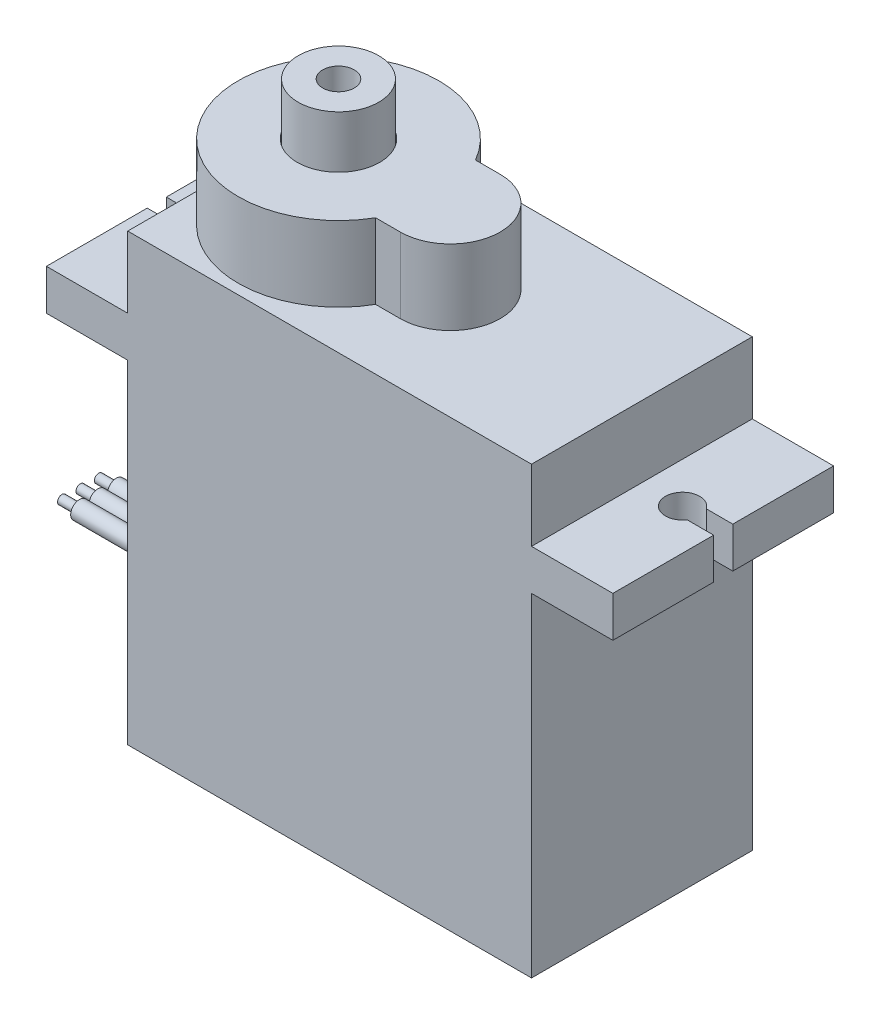
from build123d import *

# Parameters (mm, degrees)
BOSS_EXTRUDE1_DEPTH      = 6.295
BOSS_EXTRUDE2_DEPTH      = 4.28
SKETCH4_R                = 0.975
SKETCH4_W                = 1.511544683
SKETCH4_H                = 1.09
CUT_EXTRUDE1_DEPTH       = 29.67958551
SKETCH5_R                = 1
SKETCH5_R_2              = 0.975
CUT_EXTRUDE2_DEPTH       = 1
SKETCH6_R                = 0.5
BOSS_EXTRUDE4_DEPTH      = 8
SKETCH7_R                = 0.25
BOSS_EXTRUDE5_DEPTH      = 1
FILLET1_R                = 0.3
BOSS_EXTRUDE6_DEPTH      = 2.95
BOSS_EXTRUDE6_DEPTH_BACK = 1
SKETCH12_R               = 2.3
SKETCH12_R_2             = 0.9
SKETCH13_R               = 2.35
CUT_EXTRUDE5_DEPTH       = 5


with BuildPart() as part:
    # Sketch1 → Boss-Extrude1 (new, symmetric)
    with BuildSketch(Plane.XY):
        Polygon((-7.13, 6.38), (15.9, 6.38), (15.9, 2.32), (20.54, 2.32), (20.54, 0), (15.9, 0), (15.9, -19), (-7.13, -19), (-7.13, 0), (-11.77, 0), (-11.77, 2.32), (-7.13, 2.32), align=None)
    extrude(amount=BOSS_EXTRUDE1_DEPTH, both=True)

    # Sketch2 → Boss-Extrude2 (add)
    with BuildSketch(Plane(origin=(0, 6.38, 0), x_dir=(1, 0, 0), z_dir=(0, 1, 0))):
        with BuildLine():
            Line((3.560191336, -2.85), (4.97, -2.85))
            ThreePointArc((4.97, -2.85), (7.82, 0), (4.97, 2.85))
            Line((4.97, 2.85), (3.560191336, 2.85))
            ThreePointArc((3.560191336, 2.85), (-7.13, 0), (3.560191336, -2.85))
        make_face()
    extrude(amount=BOSS_EXTRUDE2_DEPTH)

    # Sketch4 → Cut-Extrude1 (cut, through all)
    with BuildSketch(Plane(origin=(0, 0, 0), x_dir=(1, 0, 0), z_dir=(0, 1, 0))):
        with Locations((-9.45, 0)):
            Circle(SKETCH4_R)
        with Locations((-11.014227659, 0)):
            Rectangle(SKETCH4_W, SKETCH4_H)
    cut_extrude1 = extrude(amount=CUT_EXTRUDE1_DEPTH, mode=Mode.SUBTRACT)

    # Mirror2: Cut-Extrude1 across plane
    add(cut_extrude1.mirror(Plane(origin=(4.385, -13.5, 6.295), x_dir=(0, 0, 1), z_dir=(-1, 0, 0))), mode=Mode.SUBTRACT)

    # Sketch5 → Cut-Extrude2 (cut)
    # profile 1 of 4: a face of its own
    with BuildSketch(Plane.XZ.offset(19)):
        with Locations((-5.49, 4.35)):
            Circle(SKETCH5_R)
        with Locations((-5.49, 4.35)):
            Circle(SKETCH5_R_2, mode=Mode.SUBTRACT)
    # profile 2 of 4: a face of its own
    with BuildSketch(Plane.XZ.offset(19)):
        with Locations((-5.49, -4.35)):
            Circle(SKETCH5_R)
        with Locations((-5.49, -4.35)):
            Circle(SKETCH5_R_2, mode=Mode.SUBTRACT)
    # profile 3 of 4: a face of its own
    with BuildSketch(Plane.XZ.offset(19)):
        with Locations((14.26, -4.35)):
            Circle(SKETCH5_R)
        with Locations((14.26, -4.35)):
            Circle(SKETCH5_R_2, mode=Mode.SUBTRACT)
    # profile 4 of 4: a face of its own
    with BuildSketch(Plane.XZ.offset(19)):
        with Locations((14.26, 4.35)):
            Circle(SKETCH5_R)
        with Locations((14.26, 4.35)):
            Circle(SKETCH5_R_2, mode=Mode.SUBTRACT)
    extrude(amount=-CUT_EXTRUDE2_DEPTH, mode=Mode.SUBTRACT)

    # Sketch6 → Boss-Extrude4 (add)
    with BuildSketch(Plane.ZY.offset(7.13)):
        with Locations((0, -14)):
            Circle(SKETCH6_R)
        with Locations((1.05, -14)):
            Circle(SKETCH6_R)
        with Locations((-1.05, -14)):
            Circle(SKETCH6_R)
    extrude(amount=BOSS_EXTRUDE4_DEPTH)

    # Sketch7 → Boss-Extrude5 (add)
    with BuildSketch(Plane.ZY.offset(15.13)):
        with Locations((0, -14)):
            Circle(SKETCH7_R)
        with Locations((1.05, -14)):
            Circle(SKETCH7_R)
        with Locations((-1.05, -14)):
            Circle(SKETCH7_R)
    extrude(amount=BOSS_EXTRUDE5_DEPTH)

    # Fillet1
    fillet1_edges = [part.edges().sort_by_distance(p)[0] for p in [
        (13.285, -19, -4.35),
        (13.285, -19, 4.35),
        (-6.465, -19, -4.35),
        (-6.465, -19, 4.35),
    ]]
    fillet(fillet1_edges, radius=FILLET1_R)

    # Sketch13 → Cut-Extrude5 (cut)
    with BuildSketch(Plane(origin=(0, 13.61, 0), x_dir=(1, 0, 0), z_dir=(0, 1, 0))):
        with Locations((-1.405, 0)):
            Circle(SKETCH13_R)
    extrude(amount=-CUT_EXTRUDE5_DEPTH, mode=Mode.SUBTRACT)


with BuildPart() as body_2:
    # Sketch12 → Boss-Extrude6 (new, two sides: drawn at the far end of the back side and taken through both)
    with BuildSketch(Plane(origin=(0, 10.66, 0), x_dir=(1, 0, 0), z_dir=(0, 1, 0)).offset(-BOSS_EXTRUDE6_DEPTH_BACK)):
        with Locations((-1.405, 0)):
            Circle(SKETCH12_R)
        with Locations((-1.405, 0)):
            Circle(SKETCH12_R_2, mode=Mode.SUBTRACT)
    extrude(amount=BOSS_EXTRUDE6_DEPTH + BOSS_EXTRUDE6_DEPTH_BACK)


solid = Compound([part.part, body_2.part])
